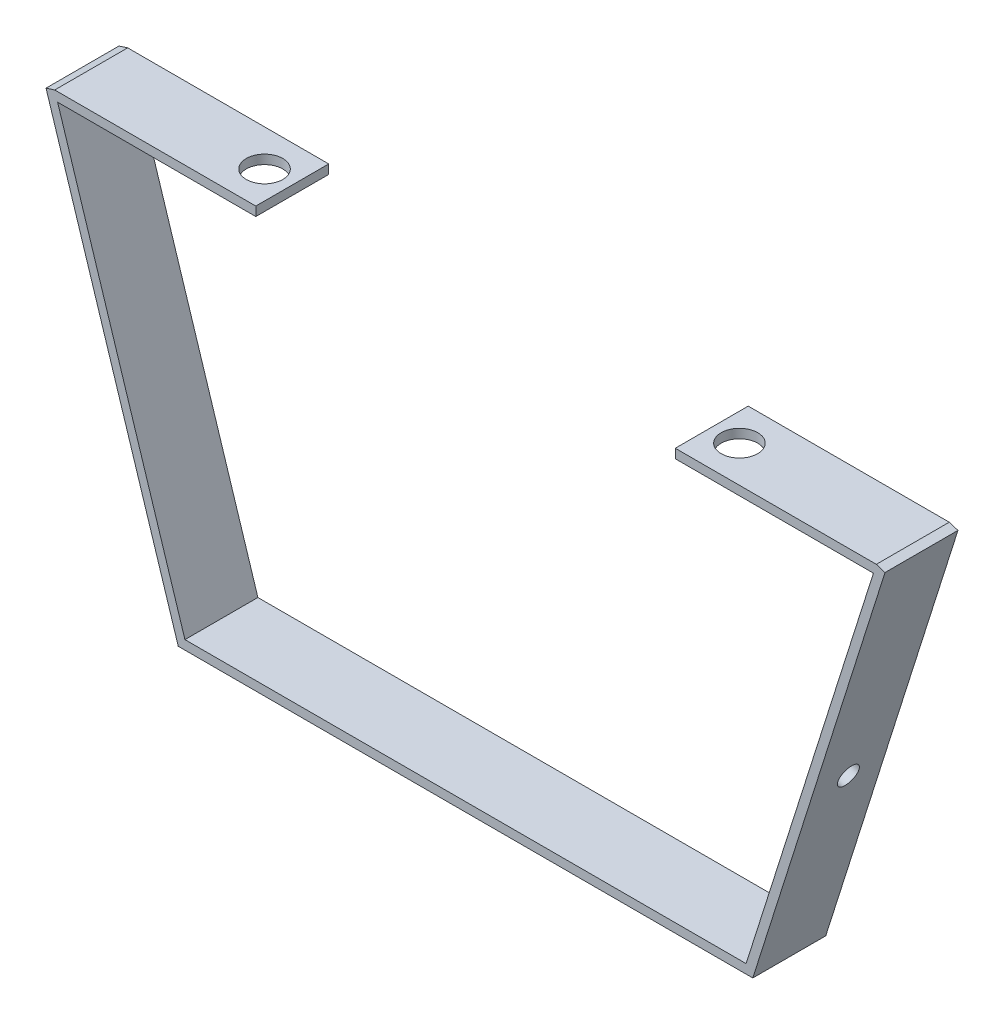
from build123d import *

# Parameters (mm, degrees)
BOSS_EXTRUDE1_DEPTH = 25.4
BOSS_EXTRUDE2_DEPTH = 25.4
SKETCH6_R           = 6.35
CUT_EXTRUDE1_DEPTH  = 10
SKETCH7_R           = 3.675
CUT_EXTRUDE2_DEPTH  = 3.175


with BuildPart() as part:
    # Sketch1 → Boss-Extrude1 (new body)
    with BuildSketch(Plane.XY):
        Polygon((-95.914729745, -24.450906393), (104.110270255, -24.450906393), (150.147770255, 120.829197523), (147.121101424, 121.788312106), (101.785788593, -21.275906393), (-93.590248082, -21.275906393), (-138.925560913, 121.788312106), (-141.952229745, 120.829197523), align=None)
    extrude(amount=BOSS_EXTRUDE1_DEPTH)

    # Sketch4 → Boss-Extrude2 (add)
    with BuildSketch(Plane(origin=(0, 0, 0), x_dir=(-1, 0, 0), z_dir=(0, 0, -1))):
        Polygon((-77.121101424, 121.788312106), (-147.121101424, 121.788312106), (-146.114982495, 118.613312106), (-77.121101424, 118.613312106), align=None)
        Polygon((138.925560913, 121.788312106), (68.925560913, 121.788312106), (68.925560913, 118.613312106), (137.919441985, 118.613312106), align=None)
    extrude(amount=-BOSS_EXTRUDE2_DEPTH)

    # Sketch6 → Cut-Extrude1 (cut)
    with BuildSketch(Plane(origin=(0, 121.788312106, 0), x_dir=(1, 0, 0), z_dir=(0, 1, 0))):
        with Locations((-78.575560913, -12.7)):
            Circle(SKETCH6_R)
        with Locations((86.771101424, -12.7)):
            Circle(SKETCH6_R)
    extrude(amount=-CUT_EXTRUDE1_DEPTH, mode=Mode.SUBTRACT)

    # Sketch7 → Cut-Extrude2 (cut)
    with BuildSketch(Plane(origin=(101.650894981, -32.211933717, 0), x_dir=(0, 0, -1), z_dir=(0.9532815217564129, -0.3020833333333334, 0))):
        with Locations((-12.7, 76.285872314)):
            Circle(SKETCH7_R)
    extrude(amount=-CUT_EXTRUDE2_DEPTH, mode=Mode.SUBTRACT)


solid = part.part
